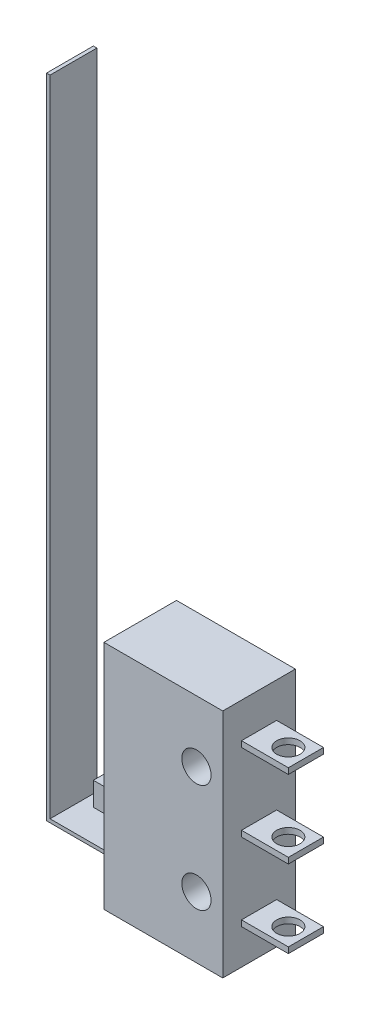
from build123d import *

# Parameters (mm, degrees)
SKETCH1_W           = 10.15
SKETCH1_H           = 19.75
BOSS_EXTRUDE1_DEPTH = 6.2
SKETCH2_W           = 4
SKETCH2_H           = 2
BOSS_EXTRUDE2_DEPTH = 2
SKETCH3_W           = 4
SKETCH3_H           = 0.3
BOSS_EXTRUDE3_DEPTH = 6
SKETCH4_W           = 0.3
SKETCH4_H           = 4
BOSS_EXTRUDE4_DEPTH = 55
SKETCH5_W           = 3
SKETCH5_H           = 0.5
BOSS_EXTRUDE5_DEPTH = 4
SKETCH6_R           = 1
CUT_EXTRUDE1_DEPTH  = 45.329053678
SKETCH7_R           = 1.25
CUT_EXTRUDE2_DEPTH  = 61.312125647


with BuildPart() as part:
    # Sketch1 → Boss-Extrude1 (new body)
    with BuildSketch(Plane.XY):
        with Locations((5.075, 9.875)):
            Rectangle(SKETCH1_W, SKETCH1_H)
    extrude(amount=-BOSS_EXTRUDE1_DEPTH)

    # Sketch2 → Boss-Extrude2 (add)
    with BuildSketch(Plane.ZY):
        with Locations((-3.1, 7)):
            Rectangle(SKETCH2_W, SKETCH2_H)
    extrude(amount=BOSS_EXTRUDE2_DEPTH)

    # Sketch3 → Boss-Extrude3 (add)
    with BuildSketch(Plane.ZY):
        with Locations((-3.1, 3.15)):
            Rectangle(SKETCH3_W, SKETCH3_H)
    extrude(amount=BOSS_EXTRUDE3_DEPTH)

    # Sketch4 → Boss-Extrude4 (add)
    with BuildSketch(Plane(origin=(0, 3.3, 0), x_dir=(1, 0, 0), z_dir=(0, 1, 0))):
        with Locations((-5.85, 3.1)):
            Rectangle(SKETCH4_W, SKETCH4_H)
    extrude(amount=BOSS_EXTRUDE4_DEPTH)

    # Sketch5 → Boss-Extrude5 (add)
    with BuildSketch(Plane(origin=(10.15, 0, 0), x_dir=(0, 0, -1), z_dir=(1, 0, 0))):
        with Locations((3.1, 3.25)):
            Rectangle(SKETCH5_W, SKETCH5_H)
        with Locations((3.1, 9.875)):
            Rectangle(SKETCH5_W, SKETCH5_H)
        with Locations((3.1, 16.5)):
            Rectangle(SKETCH5_W, SKETCH5_H)
    extrude(amount=BOSS_EXTRUDE5_DEPTH)

    # Sketch6 → Cut-Extrude1 (cut, through all)
    with BuildSketch(Plane(origin=(0, 16.75, 0), x_dir=(1, 0, 0), z_dir=(0, 1, 0))):
        with Locations((12.65, 3.1)):
            Circle(SKETCH6_R)
    extrude(amount=-CUT_EXTRUDE1_DEPTH, mode=Mode.SUBTRACT)

    # Sketch7 → Cut-Extrude2 (cut, through all)
    with BuildSketch(Plane.XY):
        with Locations((7.9, 5.25)):
            Circle(SKETCH7_R)
        with Locations((7.9, 14.5)):
            Circle(SKETCH7_R)
    extrude(amount=-CUT_EXTRUDE2_DEPTH, mode=Mode.SUBTRACT)


solid = part.part
